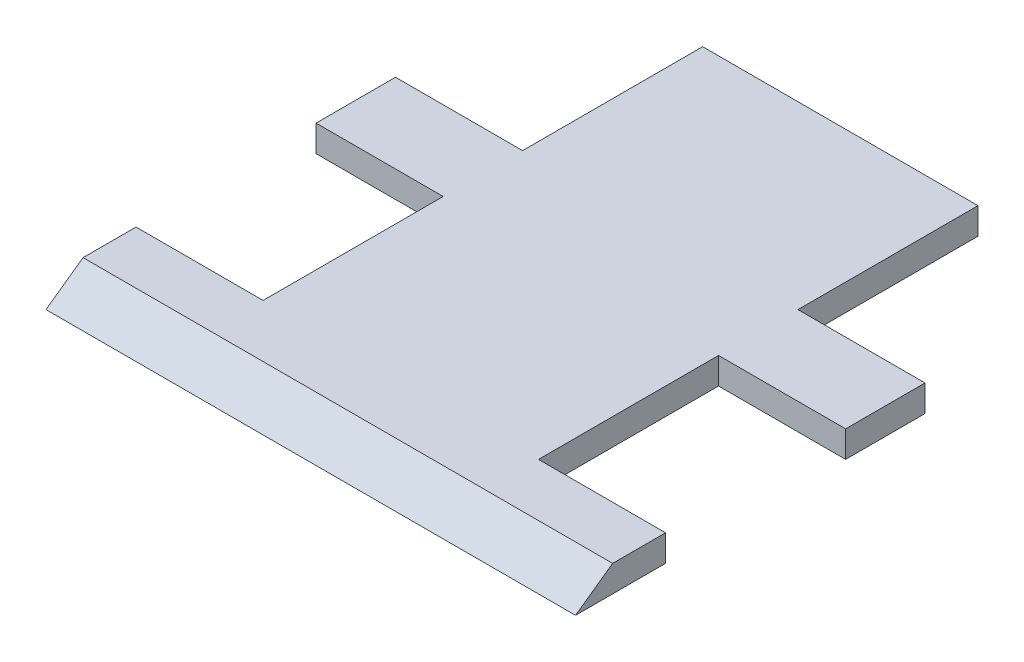
from build123d import *

# Parameters (mm, degrees)
SALIENTE_EXTRUIR1_DEPTH  = 5
CORTE_CUCHILLA_START     = 29.061909686
CORTE_CUCHILLA_OUTLINE_W = 100
CORTE_CUCHILLA_OUTLINE_H = 11
CORTE_CUCHILLA_DEPTH     = 4.938090314


with BuildPart() as part:
    # Croquis2 → Saliente-Extruir1 (new body)
    with BuildSketch(Plane(origin=(0, 0, 0), x_dir=(1, 0, 0), z_dir=(0, 1, 0))):
        Polygon((-50, 1), (-50, 16), (-26, 16), (-26, 50), (26, 50), (26, 16), (50, 16), (50, 1), (26, 1), (26, -33), (50, -33), (50, -50), (-50, -50), (-50, -33), (-26, -33), (-26, 1), align=None)
    extrude(amount=SALIENTE_EXTRUIR1_DEPTH)

    # Corte-Cuchilla: read off the stored shape, not the designer's step
    # Corte-Cuchilla outline → Corte-Cuchilla (cut)
    with BuildSketch(Plane(origin=(0, 0, 0), x_dir=(1, 0, 0), z_dir=(0, 0.8137334712067352, 0.5812381937190961)).offset(CORTE_CUCHILLA_START)):
        with Locations((0, -36.5)):
            Rectangle(CORTE_CUCHILLA_OUTLINE_W, CORTE_CUCHILLA_OUTLINE_H)
    extrude(amount=CORTE_CUCHILLA_DEPTH, mode=Mode.SUBTRACT)


solid = part.part
